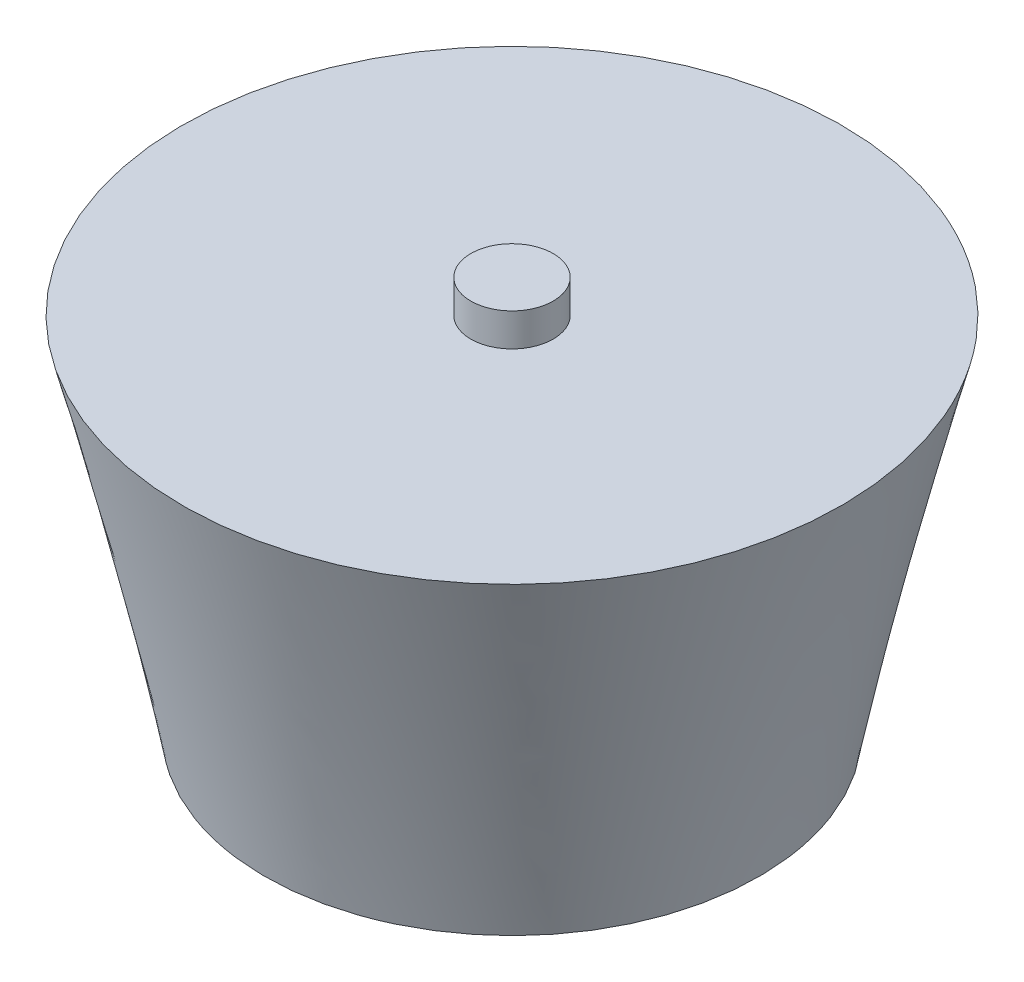
from build123d import *

# Parameters (mm, degrees)
SKETCH3_R           = 2.5
BOSS_EXTRUDE1_DEPTH = 2


with BuildPart() as part:
    # Loft1: read off the stored shape, not the designer's step
    # Loft1: loft between two sections, ruled curve by curve
    loft1_from = [
        Edge.make_bspline([(-14.008223016, 22, 14.274792046), (-42.557807107, 22, -13.741653986), (-14.541361075, 22, -42.291238077), (14.008223016, 22, -14.274792046), (42.557807107, 22, 13.741653986), (14.541361075, 22, 42.291238077), (-14.008223016, 22, 14.274792046)], [0, 0, 0, 0, 0.5, 0.5, 0.5, 1, 1, 1, 1], 3, [1, 0.333333333, 0.333333333, 1, 0.333333333, 0.333333333, 1]),
    ]
    loft1_to = [
        Edge.make_bspline([(-6.751009049, 0, 13.394919814), (-33.540848677, 0, -0.107098284), (-20.038830579, 0, -26.896937912), (6.751009049, 0, -13.394919814), (33.540848677, 0, 0.107098284), (20.038830579, 0, 26.896937912), (-6.751009049, 0, 13.394919814)], [0, 0, 0, 0, 0.5, 0.5, 0.5, 1, 1, 1, 1], 3, [1, 0.333333333, 0.333333333, 1, 0.333333333, 0.333333333, 1]),
    ]
    loft1 = Solid(Shell([*[Face.make_surface_from_curves(loft1_from[k], loft1_to[k]) for k in range(1)], Face(Wire(loft1_from)), Face(Wire(loft1_to))]))
    add(loft1)

    # Sketch3 → Boss-Extrude1 (add)
    with BuildSketch(Plane(origin=(0, 22, 0), x_dir=(1, 0, 0), z_dir=(0, 1, 0))):
        with Locations(Location((0, 0, 0), (0, 0, 270))):
            Circle(SKETCH3_R)
    extrude(amount=BOSS_EXTRUDE1_DEPTH)


solid = part.part
